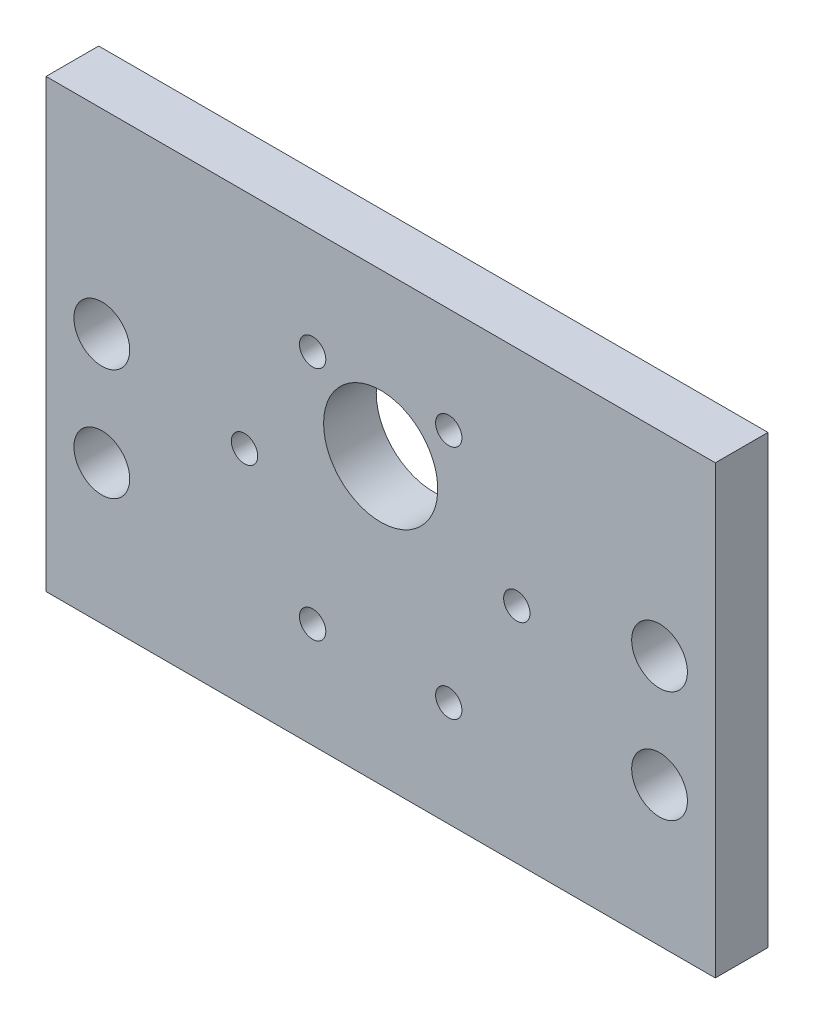
from build123d import *

# Parameters (mm, degrees)
SKETCH1_W           = 76.2
SKETCH1_H           = 50.8
SKETCH1_R           = 6.5
SKETCH1_R_2         = 1.5
SKETCH1_R_3         = 3.175
BOSS_EXTRUDE1_DEPTH = 5.9944


with BuildPart() as part:
    # Sketch1 → Boss-Extrude1 (new body)
    with BuildSketch(Plane.XY):
        with Locations((38.1, 25.4)):
            Rectangle(SKETCH1_W, SKETCH1_H)
        with Locations((38.1, 32.4)):
            Circle(SKETCH1_R, mode=Mode.SUBTRACT)
        with Locations((22.6, 25.4)):
            Circle(SKETCH1_R_2, mode=Mode.SUBTRACT)
        with Locations((53.6, 25.4)):
            Circle(SKETCH1_R_2, mode=Mode.SUBTRACT)
        with Locations((45.85, 11.976606241)):
            Circle(SKETCH1_R_2, mode=Mode.SUBTRACT)
        with Locations((30.35, 11.976606241)):
            Circle(SKETCH1_R_2, mode=Mode.SUBTRACT)
        with Locations((30.35, 38.823393759)):
            Circle(SKETCH1_R_2, mode=Mode.SUBTRACT)
        with Locations((45.85, 38.823393759)):
            Circle(SKETCH1_R_2, mode=Mode.SUBTRACT)
        with Locations((6.35, 28.575)):
            Circle(SKETCH1_R_3, mode=Mode.SUBTRACT)
        with Locations((6.35, 15.875)):
            Circle(SKETCH1_R_3, mode=Mode.SUBTRACT)
        with Locations((69.85, 28.575)):
            Circle(SKETCH1_R_3, mode=Mode.SUBTRACT)
        with Locations((69.85, 15.875)):
            Circle(SKETCH1_R_3, mode=Mode.SUBTRACT)
    extrude(amount=BOSS_EXTRUDE1_DEPTH)


solid = part.part
